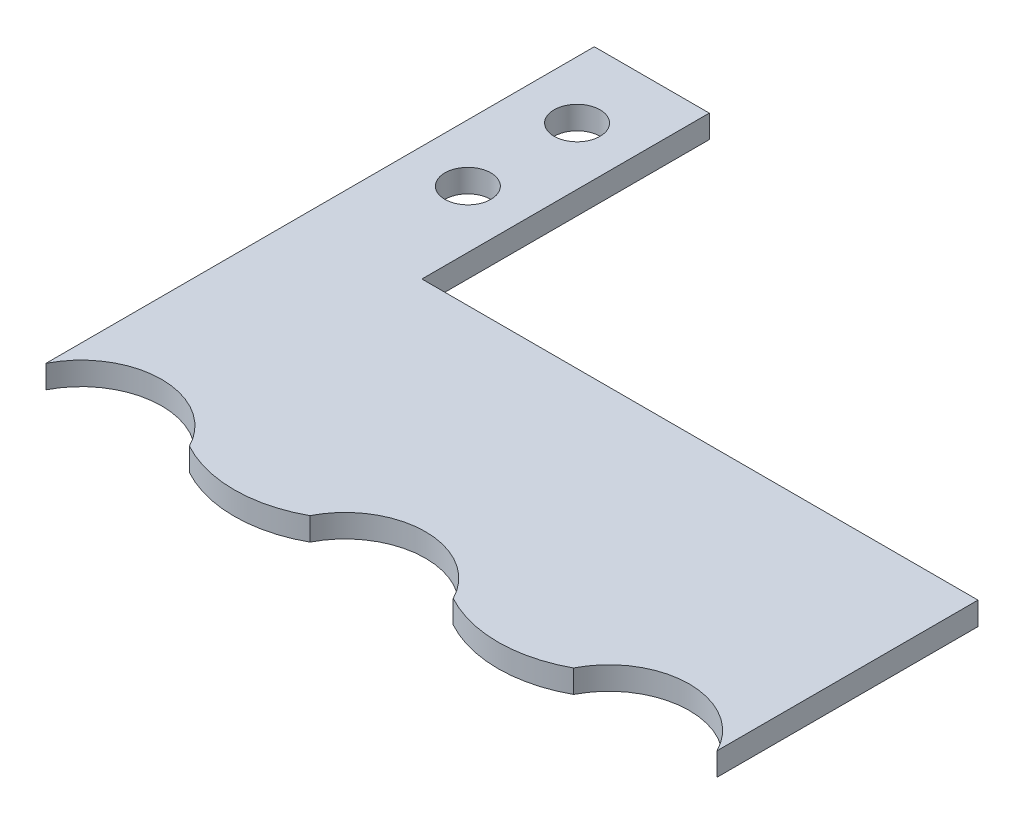
from build123d import *

# Parameters (mm, degrees)
BASE_FLANGE1_START = -2
BASE_FLANGE1_DEPTH = 2
SKETCH8_R          = 2
CUT_EXTRUDE1_DEPTH = 2


# Read off the part's stored shape, not the designer's step: Base-Flange1
with BuildPart() as part:
    # Base-Flange1 outline → Base-Flange1 (new body)
    with BuildSketch(Plane(origin=(0, 0, 0), x_dir=(1, 0, 0), z_dir=(0, 1, 0)).offset(BASE_FLANGE1_START)):
        with BuildLine():
            ThreePointArc((-29.187643745, 3.176759435), (-22.95, 7), (-16.712356255, 3.176759435))
            ThreePointArc((-16.712356255, 3.176759435), (-11.475, 1.832537182), (-6.237643745, 3.176759435))
            ThreePointArc((-6.237643745, 3.176759435), (0, 7), (6.237643745, 3.176759435))
            ThreePointArc((6.237643745, 3.176759435), (11.475, 1.832537182), (16.712356255, 3.176759435))
            ThreePointArc((16.712356255, 3.176759435), (22.95, 7), (29.187643745, 3.176759435))
            Line((29.187643745, 3.176759435), (29.187643745, 25.875))
            Line((29.187643745, 25.875), (-19.187643745, 25.875))
            Line((-19.187643745, 25.875), (-19.187643745, 50.875))
            Line((-19.187643745, 50.875), (-29.187643745, 50.875))
            Line((-29.187643745, 50.875), (-29.187643745, 3.176759435))
        make_face()
    extrude(amount=BASE_FLANGE1_DEPTH)

    # Sketch8 → Cut-Extrude1 (cut)
    with BuildSketch(Plane(origin=(0, 0, 0), x_dir=(1, 0, 0), z_dir=(0, 1, 0))):
        with Locations(Location((-24.187643745, 44.375, 0), (0, 0, 270))):
            Circle(SKETCH8_R)
        with Locations(Location((-24.187643745, 34.875, 0), (0, 0, 270))):
            Circle(SKETCH8_R)
    extrude(amount=-CUT_EXTRUDE1_DEPTH, mode=Mode.SUBTRACT)


solid = part.part
